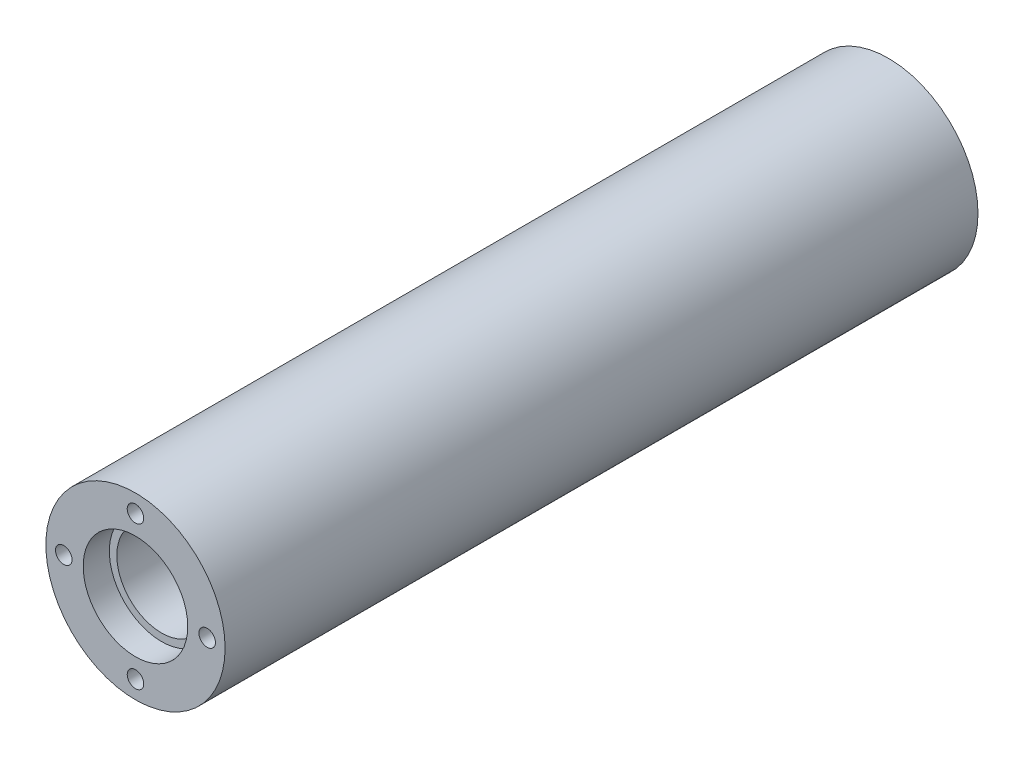
from build123d import *

# Parameters (mm, degrees)
SKETCH1_R           = 19.05
SKETCH1_R_2         = 9.525
BOSS_EXTRUDE1_DEPTH = 160.02
SKETCH2_R           = 1.7526
CUT_EXTRUDE1_DEPTH  = 9.525
CUT_EXTRUDE2_START  = -9.525
SKETCH3_R           = 1.7526
CUT_EXTRUDE2_DEPTH  = 9.525
SKETCH6_R           = 11.1125
CUT_EXTRUDE3_DEPTH  = 5.55625
CUT_EXTRUDE4_START  = -5.55625
SKETCH7_R           = 11.1125
CUT_EXTRUDE4_DEPTH  = 5.55625


with BuildPart() as part:
    # Sketch1 → Boss-Extrude1 (new body)
    with BuildSketch(Plane.XY):
        Circle(SKETCH1_R)
        Circle(SKETCH1_R_2, mode=Mode.SUBTRACT)
    extrude(amount=BOSS_EXTRUDE1_DEPTH)

    # Sketch2 → Cut-Extrude1 (cut)
    with BuildSketch(Plane(origin=(0, 0, 0), x_dir=(-1, 0, 0), z_dir=(0, 0, -1))):
        with Locations((0, 15.24)):
            Circle(SKETCH2_R)
        with Locations((15.24, 0)):
            Circle(SKETCH2_R)
        with Locations((0, -15.24)):
            Circle(SKETCH2_R)
        with Locations((-15.24, 0)):
            Circle(SKETCH2_R)
    extrude(amount=-CUT_EXTRUDE1_DEPTH, mode=Mode.SUBTRACT)

    # Sketch3 → Cut-Extrude2 (cut)
    with BuildSketch(Plane.XY.offset(160.02).offset(CUT_EXTRUDE2_START)):
        with Locations((0, 15.24)):
            Circle(SKETCH3_R)
        with Locations((15.24, 0)):
            Circle(SKETCH3_R)
        with Locations((0, -15.24)):
            Circle(SKETCH3_R)
        with Locations((-15.24, 0)):
            Circle(SKETCH3_R)
    extrude(amount=CUT_EXTRUDE2_DEPTH, mode=Mode.SUBTRACT)

    # Sketch6 → Cut-Extrude3 (cut)
    with BuildSketch(Plane.XY.offset(160.02)):
        Circle(SKETCH6_R)
    extrude(amount=-CUT_EXTRUDE3_DEPTH, mode=Mode.SUBTRACT)

    # Sketch7 → Cut-Extrude4 (cut)
    with BuildSketch(Plane(origin=(0, 0, 0), x_dir=(-1, 0, 0), z_dir=(0, 0, -1)).offset(CUT_EXTRUDE4_START)):
        Circle(SKETCH7_R)
    extrude(amount=CUT_EXTRUDE4_DEPTH, mode=Mode.SUBTRACT)


solid = part.part
